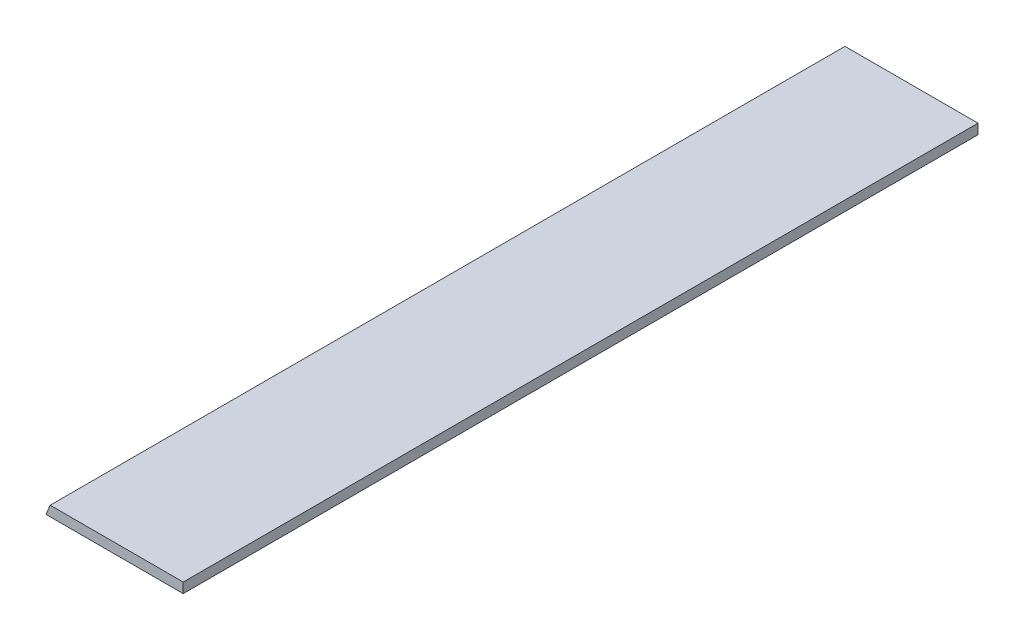
from build123d import *

# Parameters (mm, degrees)
BOSS_EXTRUDE1_DEPTH = 501.65


with BuildPart() as part:
    # Sketch1 → Boss-Extrude1 (new body)
    with BuildSketch(Plane.XY):
        Polygon((0, 0), (2.630256121, 6.35), (86.614, 6.35), (86.614, 0), align=None)
    extrude(amount=BOSS_EXTRUDE1_DEPTH)


solid = part.part
